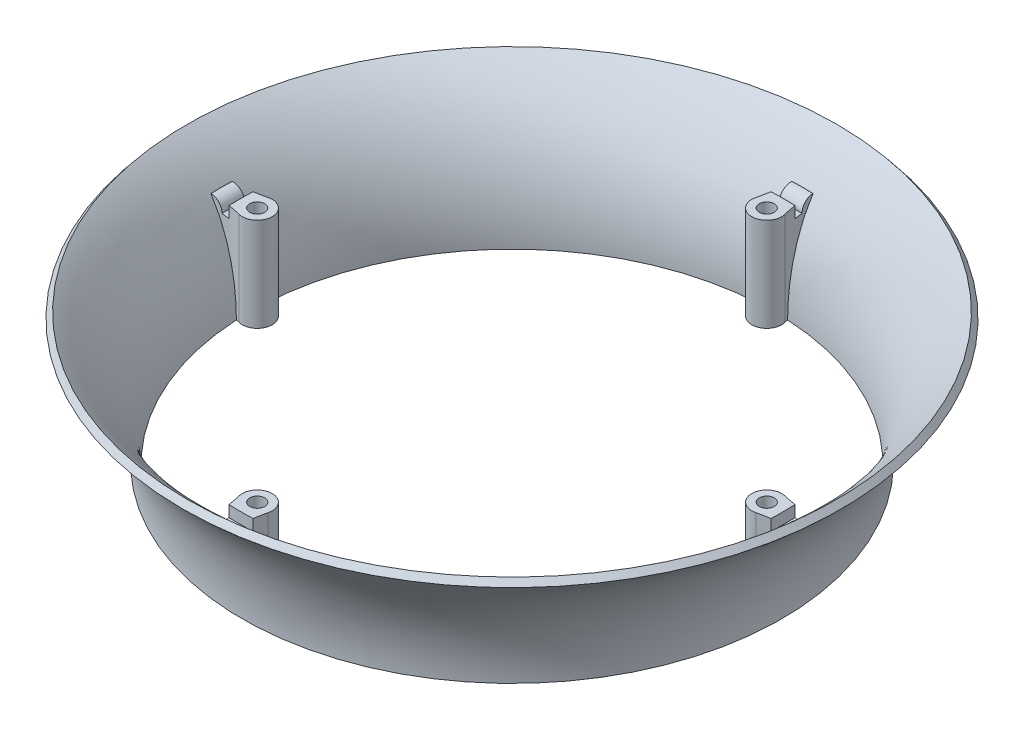
from build123d import *

# Parameters (mm, degrees)
SKETCH2_R           = 2
BOSS_EXTRUDE1_DEPTH = 25
SKETCH4_R           = 74.5
SKETCH4_R_2         = 72.4
CUT_EXTRUDE1_DEPTH  = 3
FILLET1_R           = 3


with BuildPart() as part:
    # Sketch1 → Revolve-Thin1 (revolve)
    with BuildSketch(Plane.XY, mode=Mode.PRIVATE) as revolve_thin1_sk:
        with BuildLine():
            ThreePointArc((-70, 0), (-74.393398282, 19.393398282), (-86.715728753, 35))
            Line((-86.715728753, 35), (-87.972807475, 33.444444444))
            ThreePointArc((-87.972807475, 33.444444444), (-76.198136136, 18.53146947), (-72, 0))
            Line((-72, 0), (-70, 0))
        make_face()
    revolve(revolve_thin1_sk.sketch.rotate(Axis((0, 0, 0), (0, 1, 0)), 270), axis=Axis((0, 0, 0), (0, 1, 0)))

    # Sketch2 → Boss-Extrude1 (add)
    # profile 1 of 4: a face of its own
    with BuildSketch(Plane(origin=(0, 25, 0), x_dir=(-1, 0, 0), z_dir=(0, -1, 0))):
        with BuildLine():
            ThreePointArc((3.8828898, -68.960815695), (2.829681089, -77.845605343), (4, -86.715728753))
            Line((4, -86.715728753), (-4, -86.715728753))
            ThreePointArc((-4, -86.715728753), (-2.829681089, -77.845605343), (-3.8828898, -68.960815695))
            ThreePointArc((-3.8828898, -68.960815695), (0, -64), (3.8828898, -68.960815695))
        make_face()
        with Locations(Location((0, -68, 0), (0, 0, 90))):
            Circle(SKETCH2_R, mode=Mode.SUBTRACT)
    # profile 2 of 4: a face of its own
    with BuildSketch(Plane(origin=(0, 25, 0), x_dir=(-1, 0, 0), z_dir=(0, -1, 0))):
        with BuildLine():
            ThreePointArc((68.960815695, 3.8828898), (77.845605343, 2.829681089), (86.715728753, 4))
            Line((86.715728753, 4), (86.715728753, -4))
            ThreePointArc((86.715728753, -4), (77.845605343, -2.829681089), (68.960815695, -3.8828898))
            ThreePointArc((68.960815695, -3.8828898), (64, 0), (68.960815695, 3.8828898))
        make_face()
        with Locations(Location((68, 0, 0), (0, 0, 90))):
            Circle(SKETCH2_R, mode=Mode.SUBTRACT)
    # profile 3 of 4: a face of its own
    with BuildSketch(Plane(origin=(0, 25, 0), x_dir=(-1, 0, 0), z_dir=(0, -1, 0))):
        with BuildLine():
            ThreePointArc((-3.8828898, 68.960815695), (-2.829681089, 77.845605343), (-4, 86.715728753))
            Line((-4, 86.715728753), (4, 86.715728753))
            ThreePointArc((4, 86.715728753), (2.829681089, 77.845605343), (3.8828898, 68.960815695))
            ThreePointArc((3.8828898, 68.960815695), (0, 64), (-3.8828898, 68.960815695))
        make_face()
        with Locations(Location((0, 68, 0), (0, 0, 90))):
            Circle(SKETCH2_R, mode=Mode.SUBTRACT)
    # profile 4 of 4: a face of its own
    with BuildSketch(Plane(origin=(0, 25, 0), x_dir=(-1, 0, 0), z_dir=(0, -1, 0))):
        with BuildLine():
            ThreePointArc((-86.624516405, 3.976275972), (-86.692922667, 1.988661001), (-86.715728753, 0))
            ThreePointArc((-86.715728753, 0), (-86.692922667, -1.988661001), (-86.624516405, -3.976275972))
            ThreePointArc((-86.624516405, -3.976275972), (-77.798482599, -2.829401113), (-68.960815695, -3.8828898))
            ThreePointArc((-68.960815695, -3.8828898), (-64, 0), (-68.960815695, 3.8828898))
            ThreePointArc((-68.960815695, 3.8828898), (-77.798482599, 2.829401113), (-86.624516405, 3.976275972))
        make_face()
        with Locations(Location((-68, 0, 0), (0, 0, 90))):
            Circle(SKETCH2_R, mode=Mode.SUBTRACT)
    extrude(amount=BOSS_EXTRUDE1_DEPTH)

    # Sketch3 → Cut-Revolve1 (revolve, cut)
    with BuildSketch(Plane.XY, mode=Mode.PRIVATE) as cut_revolve1_sk:
        with BuildLine():
            Line((-72, 0), (-99.127196695, 0))
            Line((-99.127196695, 0), (-99.127196695, 33.444444444))
            Line((-99.127196695, 33.444444444), (-87.972807475, 33.444444444))
            ThreePointArc((-87.972807475, 33.444444444), (-76.198136136, 18.53146947), (-72, 0))
        make_face()
    revolve(cut_revolve1_sk.sketch.rotate(Axis((0, 0, 0), (0, 1, 0)), 270), axis=Axis((0, 0, 0), (0, 1, 0)), mode=Mode.SUBTRACT)

    # Sketch4 → Cut-Extrude1 (cut)
    with BuildSketch(Plane(origin=(0, 25, 0), x_dir=(1, 0, 0), z_dir=(0, 1, 0))):
        Circle(SKETCH4_R)
        Circle(SKETCH4_R_2, mode=Mode.SUBTRACT)
    extrude(amount=-CUT_EXTRUDE1_DEPTH, mode=Mode.SUBTRACT)

    # Fillet1
    fillet1_edges = [part.edges().sort_by_distance(p)[0] for p in [
        (-74.5, 25, 0),
        (0, 25, 74.5),
        (74.5, 25, 0),
        (0, 25, -74.5),
    ]]
    fillet(fillet1_edges, radius=FILLET1_R - 0.0001)  # a hair under: the kernel refuses the full size


solid = part.part
